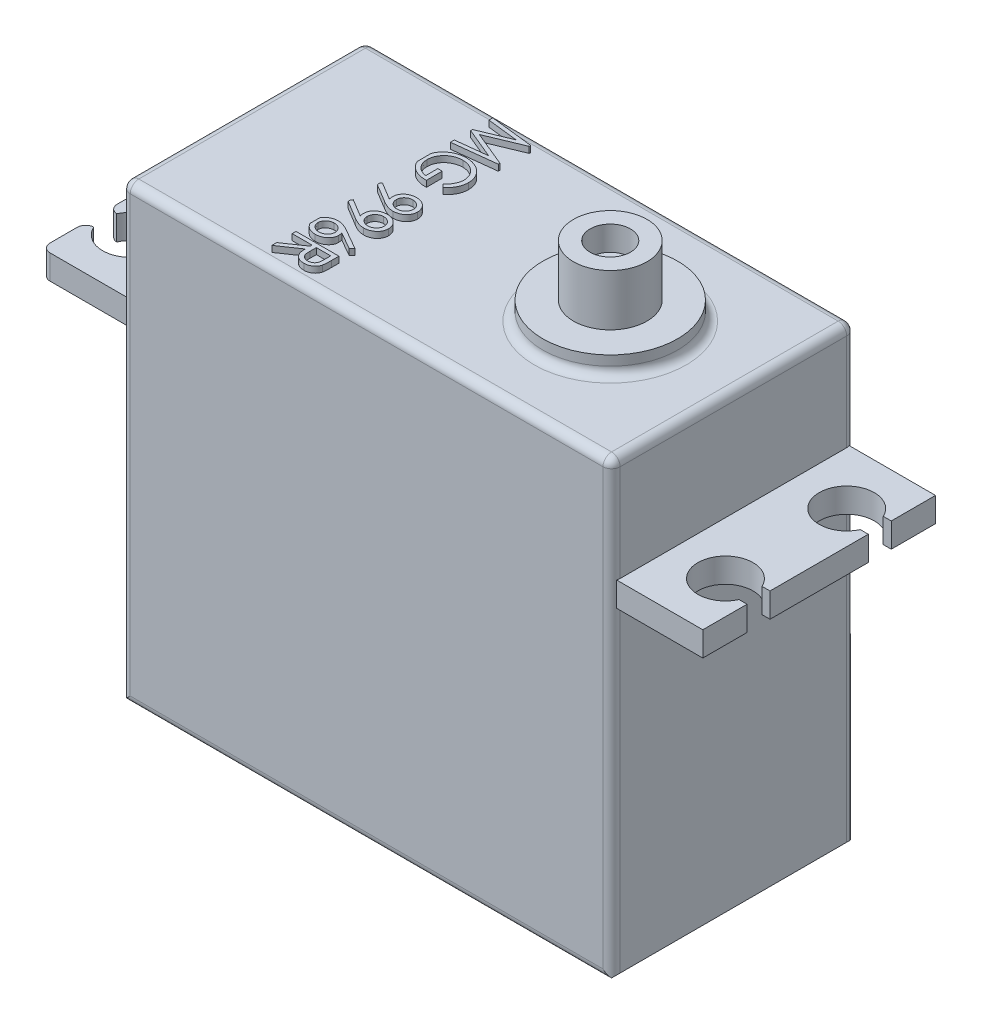
from build123d import *

# Parameters (mm, degrees)
SKETCH_1_W          = 40
SKETCH_1_H          = 26.9
EXTRUDE_1_DEPTH     = 19.9
CHAMFER_1_SIZE      = 1
SKETCH_2_W          = 20
SKETCH_2_H          = 14.45
SKETCH_2_H_2        = 4.55
SKETCH_2_H_3        = 0.45
EXTRUDE_2_DEPTH     = 2
FILLET_1_R          = 0.7
EXTRUDE_3_DEPTH     = 8.6
EXTRUDE_4_DEPTH     = 1.5
SKETCH_5_R          = 3
EXTRUDE_5_DEPTH     = 4.2
FILLET_2_R          = 0.7
EXTRUDE_6_DEPTH     = 0.5
SKETCH_7_R          = 1.65
CUT_EXTRUDE_1_DEPTH = 2


with BuildPart() as part:
    # 草图1 → 凸台-拉伸1 (new body)
    with BuildSketch(Plane.XY):
        with Locations((20, 13.45)):
            Rectangle(SKETCH_1_W, SKETCH_1_H)
    extrude(amount=-EXTRUDE_1_DEPTH)

    # 倒角1
    chamfer_1_edges = [part.edges().sort_by_distance(p)[0] for p in [
        (20, 0, 0),
        (40, 0, -9.95),
        (0, 0, -9.95),
        (20, 0, -19.9),
    ]]
    chamfer(chamfer_1_edges, length=CHAMFER_1_SIZE)

    # 草图2 → 凸台-拉伸2 (add)
    with BuildSketch(Plane(origin=(0, 26.9, 0), x_dir=(1, 0, 0), z_dir=(0, 1, 0))):
        with BuildLine():
            Line((0, 0.45), (0, 14.9))
            Line((0, 14.9), (-2.05, 14.9))
            ThreePointArc((-2.05, 14.9), (-3.819959848, 12.701804956), (-6.345165736, 13.962024993))
            Line((-6.345165736, 13.962024993), (-7, 13.962024993))
            Line((-7, 13.962024993), (-7, 5.937975007))
            Line((-7, 5.937975007), (-6.345165736, 5.937975007))
            ThreePointArc((-6.345165736, 5.937975007), (-3.819959848, 7.198195044), (-2.05, 5))
            ThreePointArc((-2.05, 5), (-3.819959848, 2.801804956), (-6.345165736, 4.062024993))
            Line((-6.345165736, 4.062024993), (-7, 4.062024993))
            Line((-7, 4.062024993), (-7, 0.45))
            Line((-7, 0.45), (0, 0.45))
        make_face()
        with BuildLine():
            Line((0, 14.9), (0, 19.45))
            Line((0, 19.45), (-7, 19.45))
            Line((-7, 19.45), (-7, 15.837975007))
            Line((-7, 15.837975007), (-6.345165736, 15.837975007))
            ThreePointArc((-6.345165736, 15.837975007), (-3.819959848, 17.098195044), (-2.05, 14.9))
            Line((-2.05, 14.9), (0, 14.9))
        make_face()
        with Locations((10, 7.675)):
            Rectangle(SKETCH_2_W, SKETCH_2_H)
        with Locations((10, 17.175)):
            Rectangle(SKETCH_2_W, SKETCH_2_H_2)
        with Locations((10, 19.675)):
            Rectangle(SKETCH_2_W, SKETCH_2_H_3)
        with Locations((10, 0.225)):
            Rectangle(SKETCH_2_W, SKETCH_2_H_3)
    extrude_2 = extrude(amount=EXTRUDE_2_DEPTH)

    # 圆角1
    # the kernel refuses this fillet: 0.7 mm, written as the material it takes off along each edge
    with BuildSketch(Plane(origin=(-7, 25.153646556, -4.062024993), x_dir=(1, 0, 0), z_dir=(0, 1, 0)), Plane(origin=(-7, 25.153646556, -13.962024993), x_dir=(1, 0, 0), z_dir=(0, 1, 0))) as fillet_1_piece_1:
        with BuildLine():
            CenterArc((0.7, -0.698541378), FILLET_1_R, 93.699435688, 86.300564312)
            Line((0, -0.698541378), (-0.014, -0.698541378))
            Line((-0.014, -0.698541378), (-0.014, 0))
            Line((-0.014, 0), (0, 0.014))
            ThreePointArc((0, 0.014), (0.327417132, 0.014), (0.65393095, 0.013970828))
            Line((0.65393095, 0.013970828), (0.654834264, 0))
        make_face()
    extrude(amount=5.492706888, mode=Mode.SUBTRACT)
    with BuildSketch(Plane(origin=(-7, 25.153646556, -5.937975007), x_dir=(0, 0, -1), z_dir=(0, 1, 0)), Plane(origin=(-7, 25.153646556, -15.837975007), x_dir=(0, 0, -1), z_dir=(0, 1, 0))) as fillet_1_piece_2:
        with BuildLine():
            CenterArc((0.698541378, -0.7), FILLET_1_R, 90, 86.300564312)
            Line((0, -0.654834264), (-0.013970828, -0.65393095))
            ThreePointArc((-0.013970828, -0.65393095), (-0.014, -0.327417132), (-0.014, 0))
            Line((-0.014, 0), (0, 0.014))
            Line((0, 0.014), (0.698541378, 0.014))
            Line((0.698541378, 0.014), (0.698541378, 0))
        make_face()
    extrude(amount=5.492706888, mode=Mode.SUBTRACT)
    with BuildSketch(Plane(origin=(-7, 25.15, -19.45), x_dir=(1, 0, 0), z_dir=(0, 1, 0)), Plane(origin=(-7, 25.15, -0.45), x_dir=(0, 0, -1), z_dir=(0, 1, 0))) as fillet_1_piece_3:
        with BuildLine():
            CenterArc((FILLET_1_R, -FILLET_1_R), FILLET_1_R, 90, 90)
            Line((0, -FILLET_1_R), (-FILLET_1_R * 0.02, -FILLET_1_R))
            Line((-FILLET_1_R * 0.02, -FILLET_1_R), (-FILLET_1_R * 0.02, FILLET_1_R * 0.02))
            Line((-FILLET_1_R * 0.02, FILLET_1_R * 0.02), (FILLET_1_R, FILLET_1_R * 0.02))
            Line((FILLET_1_R, FILLET_1_R * 0.02), (FILLET_1_R, 0))
        make_face()
    extrude(amount=5.5, mode=Mode.SUBTRACT)

    # 镜向1: 凸台-拉伸2 across plane
    add(extrude_2.mirror(Plane(origin=(20, 0, 0), x_dir=(0, 0, 1), z_dir=(1, 0, 0))))

    # 草图3 → 凸台-拉伸3 (add)
    with BuildSketch(Plane(origin=(0, 28.9, 0), x_dir=(1, 0, 0), z_dir=(0, 1, 0))):
        Polygon((40, 19.9), (0, 19.9), (0, 19.45), (0, 0.45), (0, 0), (40, 0), (40, 0.45), (40, 19.45), align=None)
    extrude(amount=EXTRUDE_3_DEPTH)

    # 草图4 → 凸台-拉伸4 (add)
    with BuildSketch(Plane(origin=(0, 37.5, 0), x_dir=(1, 0, 0), z_dir=(0, 1, 0))):
        with BuildLine():
            ThreePointArc((35.499708915, 9.95), (30, 15.393415143), (24.500291085, 9.95))
            Line((24.500291085, 9.95), (35.499708915, 9.95))
        make_face()
        with BuildLine():
            Line((35.499708915, 9.95), (24.500291085, 9.95))
            ThreePointArc((24.500291085, 9.95), (29.971707197, 4.393487915), (35.5, 9.893415143))
            ThreePointArc((35.5, 9.893415143), (35.499927228, 9.921707946), (35.499708915, 9.95))
        make_face()
    extrude(amount=EXTRUDE_4_DEPTH)

    # 草图5 → 凸台-拉伸5 (add)
    with BuildSketch(Plane(origin=(0, 39, 0), x_dir=(1, 0, 0), z_dir=(0, 1, 0))):
        with Locations(Location((30, 9.893415143, 0), (0, 0, 270))):
            Circle(SKETCH_5_R)
    extrude(amount=EXTRUDE_5_DEPTH)

    # 圆角2
    # the kernel refuses this fillet: 0.7 mm, written as the material it adds along each edge
    with BuildSketch(Plane(origin=(30, 37.5, -9.893415143), x_dir=(1, 0, 0), z_dir=(0, 0, 1))) as fillet_2_piece_1:
        with BuildLine():
            CenterArc((5.5 + FILLET_2_R, FILLET_2_R), FILLET_2_R, 180, 90)
            Line((5.5, FILLET_2_R), (5.5, 0))
            Line((5.5, 0), (5.5 + FILLET_2_R, 0))
        make_face()
    revolve(axis=Axis((30, 37.5, -9.893415143), (0, 1, 0)))
    # the kernel refuses this fillet: 0.7 mm, written as the material it takes off along each edge
    with BuildSketch(Plane(origin=(39.3, 36.8, -19.2), x_dir=(0, 1, 0), z_dir=(0, 0, -1))) as fillet_2_2_piece_1_section:
        Polygon((0, 0), (FILLET_2_R, 0), (FILLET_2_R, FILLET_2_R), (0, FILLET_2_R), align=None)
    fillet_2_2_piece_1 = extrude(amount=FILLET_2_R, mode=Mode.PRIVATE)
    fillet_2_2_piece_1 = fillet_2_2_piece_1 - Plane(origin=(39.3, 36.8, -19.2), x_dir=(-0.7071067811865475, -0.7071067811865475, 0), z_dir=(0, 0, -1)) * Sphere(FILLET_2_R, mode=Mode.PRIVATE)
    add(fillet_2_2_piece_1, mode=Mode.SUBTRACT)
    with BuildSketch(Plane(origin=(39.3, 36.8, -0.7), x_dir=(0, 0, 1), z_dir=(0, 1, 0))) as fillet_2_2_piece_2_section:
        Polygon((0, 0), (FILLET_2_R, 0), (FILLET_2_R, FILLET_2_R), (0, FILLET_2_R), align=None)
    fillet_2_2_piece_2 = extrude(amount=FILLET_2_R, mode=Mode.PRIVATE)
    fillet_2_2_piece_2 = fillet_2_2_piece_2 - Plane(origin=(39.3, 36.8, -0.7), x_dir=(-0.7071067811865475, 0, -0.7071067811865475), z_dir=(0, 1, 0)) * Sphere(FILLET_2_R, mode=Mode.PRIVATE)
    add(fillet_2_2_piece_2, mode=Mode.SUBTRACT)
    with BuildSketch(Plane(origin=(0.7, 36.8, -0.7), x_dir=(0, 0, 1), z_dir=(0, 1, 0))) as fillet_2_2_piece_3_section:
        Polygon((0, 0), (FILLET_2_R, 0), (FILLET_2_R, -FILLET_2_R), (0, -FILLET_2_R), align=None)
    fillet_2_2_piece_3 = extrude(amount=FILLET_2_R, mode=Mode.PRIVATE)
    fillet_2_2_piece_3 = fillet_2_2_piece_3 - Plane(origin=(0.7, 36.8, -0.7), x_dir=(0.7071067811865475, 0, -0.7071067811865475), z_dir=(0, 1, 0)) * Sphere(FILLET_2_R, mode=Mode.PRIVATE)
    add(fillet_2_2_piece_3, mode=Mode.SUBTRACT)
    with BuildSketch(Plane(origin=(0.7, 36.8, -19.2), x_dir=(0, 1, 0), z_dir=(0, 0, -1))) as fillet_2_2_piece_4_section:
        Polygon((0, 0), (FILLET_2_R, 0), (FILLET_2_R, -FILLET_2_R), (0, -FILLET_2_R), align=None)
    fillet_2_2_piece_4 = extrude(amount=FILLET_2_R, mode=Mode.PRIVATE)
    fillet_2_2_piece_4 = fillet_2_2_piece_4 - Plane(origin=(0.7, 36.8, -19.2), x_dir=(0.7071067811865475, -0.7071067811865475, 0), z_dir=(0, 0, -1)) * Sphere(FILLET_2_R, mode=Mode.PRIVATE)
    add(fillet_2_2_piece_4, mode=Mode.SUBTRACT)
    with BuildSketch(Plane(origin=(40, 37.5, -19.2), x_dir=(0, -1, 0), z_dir=(0, 0, 1)), Plane(origin=(0, 37.5, -0.7), x_dir=(0, -1, 0), z_dir=(0, 0, -1))) as fillet_2_2_piece_5:
        with BuildLine():
            CenterArc((FILLET_2_R, -FILLET_2_R), FILLET_2_R, 90, 90)
            Line((0, -FILLET_2_R), (0, 0))
            Line((0, 0), (FILLET_2_R, 0))
        make_face()
    extrude(amount=18.5, mode=Mode.SUBTRACT)
    with BuildSketch(Plane(origin=(0.7, 37.5, 0), x_dir=(0, -1, 0), z_dir=(1, 0, 0)), Plane(origin=(39.3, 37.5, -19.9), x_dir=(0, -1, 0), z_dir=(-1, 0, 0))) as fillet_2_2_piece_6:
        with BuildLine():
            CenterArc((FILLET_2_R, FILLET_2_R), FILLET_2_R, 180, 90)
            Line((0, FILLET_2_R), (0, 0))
            Line((0, 0), (FILLET_2_R, 0))
        make_face()
    extrude(amount=38.6, mode=Mode.SUBTRACT)
    with BuildSketch(Plane(origin=(0, 36.8, -19.9), x_dir=(0, 0, 1), z_dir=(0, -1, 0))) as fillet_2_2_piece_7_section:
        with BuildLine():
            CenterArc((FILLET_2_R, -FILLET_2_R), FILLET_2_R, 90, 90)
            Line((0, -FILLET_2_R), (0, 0))
            Line((0, 0), (FILLET_2_R, 0))
        make_face()
    fillet_2_2_piece_7 = extrude(amount=37.55, mode=Mode.PRIVATE)
    fillet_2_2_piece_7 = split(fillet_2_2_piece_7, bisect_by=Plane(origin=(0.003803526, 32.85, -19.45), z_dir=(0, 0, 1)), keep=Keep.TOP, mode=Mode.PRIVATE)
    fillet_2_2_piece_7 = split(fillet_2_2_piece_7, bisect_by=Plane(origin=(0.003803526, 28.9, -19.357731488), z_dir=(0, 1, 0)), keep=Keep.TOP, mode=Mode.PRIVATE)
    add(fillet_2_2_piece_7, mode=Mode.SUBTRACT)
    with BuildSketch(Plane(origin=(0, 36.8, -19.9), x_dir=(0, 0, 1), z_dir=(0, -1, 0))) as fillet_2_2_piece_8_section:
        with BuildLine():
            CenterArc((FILLET_2_R, -FILLET_2_R), FILLET_2_R, 90, 90)
            Line((0, -FILLET_2_R), (0, 0))
            Line((0, 0), (FILLET_2_R, 0))
        make_face()
    fillet_2_2_piece_8 = extrude(amount=37.55, mode=Mode.PRIVATE)
    fillet_2_2_piece_8 = split(fillet_2_2_piece_8, bisect_by=Plane(origin=(0.168066575, 32.85, -19.45), z_dir=(0, 0, -1)), keep=Keep.TOP, mode=Mode.PRIVATE)
    fillet_2_2_piece_8 = split(fillet_2_2_piece_8, bisect_by=Plane(origin=(0.168066575, 28.9, -19.765319179), z_dir=(0, 1, 0)), keep=Keep.TOP, mode=Mode.PRIVATE)
    add(fillet_2_2_piece_8, mode=Mode.SUBTRACT)
    with BuildSketch(Plane(origin=(0, 36.8, -19.9), x_dir=(0, 0, 1), z_dir=(0, -1, 0))) as fillet_2_2_piece_9_section:
        with BuildLine():
            CenterArc((FILLET_2_R, -FILLET_2_R), FILLET_2_R, 90, 90)
            Line((0, -FILLET_2_R), (0, 0))
            Line((0, 0), (FILLET_2_R, 0))
        make_face()
    fillet_2_2_piece_9 = extrude(amount=37.55, mode=Mode.PRIVATE)
    fillet_2_2_piece_9 = split(fillet_2_2_piece_9, bisect_by=Plane(origin=(0.168066575, 26.9, -19.765319179), z_dir=(0, 1, 0)), keep=Keep.TOP, mode=Mode.PRIVATE)
    fillet_2_2_piece_9 = split(fillet_2_2_piece_9, bisect_by=Plane(origin=(0.168066575, 27.9, -19.45), z_dir=(0, 0, -1)), keep=Keep.TOP, mode=Mode.PRIVATE)
    fillet_2_2_piece_9 = split(fillet_2_2_piece_9, bisect_by=Plane(origin=(0.168066575, 28.9, -19.765319179), z_dir=(0, -1, 0)), keep=Keep.TOP, mode=Mode.PRIVATE)
    add(fillet_2_2_piece_9, mode=Mode.SUBTRACT)
    with BuildSketch(Plane(origin=(0, 36.8, -19.9), x_dir=(0, 0, 1), z_dir=(0, -1, 0))) as fillet_2_2_piece_10_section:
        with BuildLine():
            CenterArc((FILLET_2_R, -FILLET_2_R), FILLET_2_R, 90, 90)
            Line((0, -FILLET_2_R), (0, 0))
            Line((0, 0), (FILLET_2_R, 0))
        make_face()
    fillet_2_2_piece_10 = extrude(amount=37.55, mode=Mode.PRIVATE)
    fillet_2_2_piece_10 = split(fillet_2_2_piece_10, bisect_by=Plane(origin=(0.003803526, 26.9, -19.357731488), z_dir=(0, -1, 0)), keep=Keep.TOP, mode=Mode.PRIVATE)
    fillet_2_2_piece_10 = split(fillet_2_2_piece_10, bisect_by=Plane(origin=(0.003803526, 13.075, -19.45), z_dir=(0, 0, 1)), keep=Keep.TOP, mode=Mode.PRIVATE)
    add(fillet_2_2_piece_10, mode=Mode.SUBTRACT)
    with BuildSketch(Plane(origin=(0, 36.8, -19.9), x_dir=(0, 0, 1), z_dir=(0, -1, 0))) as fillet_2_2_piece_11_section:
        with BuildLine():
            CenterArc((FILLET_2_R, -FILLET_2_R), FILLET_2_R, 90, 90)
            Line((0, -FILLET_2_R), (0, 0))
            Line((0, 0), (FILLET_2_R, 0))
        make_face()
    fillet_2_2_piece_11 = extrude(amount=37.55, mode=Mode.PRIVATE)
    fillet_2_2_piece_11 = split(fillet_2_2_piece_11, bisect_by=Plane(origin=(0.168066575, 26.9, -19.765319179), z_dir=(0, -1, 0)), keep=Keep.TOP, mode=Mode.PRIVATE)
    fillet_2_2_piece_11 = split(fillet_2_2_piece_11, bisect_by=Plane(origin=(0.168066575, 13.075, -19.45), z_dir=(0, 0, -1)), keep=Keep.TOP, mode=Mode.PRIVATE)
    add(fillet_2_2_piece_11, mode=Mode.SUBTRACT)
    with BuildSketch(Plane(origin=(0, 36.8, 0), x_dir=(1, 0, 0), z_dir=(0, -1, 0))) as fillet_2_2_piece_12_section:
        with BuildLine():
            CenterArc((FILLET_2_R, -FILLET_2_R), FILLET_2_R, 90, 90)
            Line((0, -FILLET_2_R), (0, 0))
            Line((0, 0), (FILLET_2_R, 0))
        make_face()
    fillet_2_2_piece_12 = extrude(amount=37.55, mode=Mode.PRIVATE)
    fillet_2_2_piece_12 = split(fillet_2_2_piece_12, bisect_by=Plane(origin=(0.168066575, 32.85, -0.45), z_dir=(0, 0, 1)), keep=Keep.TOP, mode=Mode.PRIVATE)
    fillet_2_2_piece_12 = split(fillet_2_2_piece_12, bisect_by=Plane(origin=(0.168066575, 28.9, -0.134680821), z_dir=(0, 1, 0)), keep=Keep.TOP, mode=Mode.PRIVATE)
    add(fillet_2_2_piece_12, mode=Mode.SUBTRACT)
    with BuildSketch(Plane(origin=(0, 36.8, 0), x_dir=(1, 0, 0), z_dir=(0, -1, 0))) as fillet_2_2_piece_13_section:
        with BuildLine():
            CenterArc((FILLET_2_R, -FILLET_2_R), FILLET_2_R, 90, 90)
            Line((0, -FILLET_2_R), (0, 0))
            Line((0, 0), (FILLET_2_R, 0))
        make_face()
    fillet_2_2_piece_13 = extrude(amount=37.55, mode=Mode.PRIVATE)
    fillet_2_2_piece_13 = split(fillet_2_2_piece_13, bisect_by=Plane(origin=(0.003803526, 32.85, -0.45), z_dir=(0, 0, -1)), keep=Keep.TOP, mode=Mode.PRIVATE)
    fillet_2_2_piece_13 = split(fillet_2_2_piece_13, bisect_by=Plane(origin=(0.003803526, 28.9, -0.542268512), z_dir=(0, 1, 0)), keep=Keep.TOP, mode=Mode.PRIVATE)
    add(fillet_2_2_piece_13, mode=Mode.SUBTRACT)
    with BuildSketch(Plane(origin=(0, 36.8, 0), x_dir=(1, 0, 0), z_dir=(0, -1, 0))) as fillet_2_2_piece_14_section:
        with BuildLine():
            CenterArc((FILLET_2_R, -FILLET_2_R), FILLET_2_R, 90, 90)
            Line((0, -FILLET_2_R), (0, 0))
            Line((0, 0), (FILLET_2_R, 0))
        make_face()
    fillet_2_2_piece_14 = extrude(amount=37.55, mode=Mode.PRIVATE)
    fillet_2_2_piece_14 = split(fillet_2_2_piece_14, bisect_by=Plane(origin=(0.168066575, 27.9, -0.45), z_dir=(0, 0, 1)), keep=Keep.TOP, mode=Mode.PRIVATE)
    fillet_2_2_piece_14 = split(fillet_2_2_piece_14, bisect_by=Plane(origin=(0.168066575, 26.9, -0.134680821), z_dir=(0, 1, 0)), keep=Keep.TOP, mode=Mode.PRIVATE)
    fillet_2_2_piece_14 = split(fillet_2_2_piece_14, bisect_by=Plane(origin=(0.168066575, 28.9, -0.134680821), z_dir=(0, -1, 0)), keep=Keep.TOP, mode=Mode.PRIVATE)
    add(fillet_2_2_piece_14, mode=Mode.SUBTRACT)
    with BuildSketch(Plane(origin=(0, 36.8, 0), x_dir=(1, 0, 0), z_dir=(0, -1, 0))) as fillet_2_2_piece_15_section:
        with BuildLine():
            CenterArc((FILLET_2_R, -FILLET_2_R), FILLET_2_R, 90, 90)
            Line((0, -FILLET_2_R), (0, 0))
            Line((0, 0), (FILLET_2_R, 0))
        make_face()
    fillet_2_2_piece_15 = extrude(amount=37.55, mode=Mode.PRIVATE)
    fillet_2_2_piece_15 = split(fillet_2_2_piece_15, bisect_by=Plane(origin=(0.168066575, 13.075, -0.45), z_dir=(0, 0, 1)), keep=Keep.TOP, mode=Mode.PRIVATE)
    fillet_2_2_piece_15 = split(fillet_2_2_piece_15, bisect_by=Plane(origin=(0.168066575, 26.9, -0.134680821), z_dir=(0, -1, 0)), keep=Keep.TOP, mode=Mode.PRIVATE)
    add(fillet_2_2_piece_15, mode=Mode.SUBTRACT)
    with BuildSketch(Plane(origin=(0, 36.8, 0), x_dir=(1, 0, 0), z_dir=(0, -1, 0))) as fillet_2_2_piece_16_section:
        with BuildLine():
            CenterArc((FILLET_2_R, -FILLET_2_R), FILLET_2_R, 90, 90)
            Line((0, -FILLET_2_R), (0, 0))
            Line((0, 0), (FILLET_2_R, 0))
        make_face()
    fillet_2_2_piece_16 = extrude(amount=37.55, mode=Mode.PRIVATE)
    fillet_2_2_piece_16 = split(fillet_2_2_piece_16, bisect_by=Plane(origin=(0.003803526, 13.075, -0.45), z_dir=(0, 0, -1)), keep=Keep.TOP, mode=Mode.PRIVATE)
    fillet_2_2_piece_16 = split(fillet_2_2_piece_16, bisect_by=Plane(origin=(0.003803526, 26.9, -0.542268512), z_dir=(0, -1, 0)), keep=Keep.TOP, mode=Mode.PRIVATE)
    add(fillet_2_2_piece_16, mode=Mode.SUBTRACT)
    with BuildSketch(Plane(origin=(-0.724873734, 1, -19.9), x_dir=(0, -0.7071067811865485, 0.7071067811865466), z_dir=(1, 0, 0))) as fillet_2_2_piece_17:
        with BuildLine():
            CenterArc((FILLET_2_R * 0.414213562373, -FILLET_2_R), FILLET_2_R, 90, 45)
            Line((-FILLET_2_R * 0.292893218813, -FILLET_2_R * 0.292893218813), (0, 0))
            Line((0, 0), (FILLET_2_R * 0.414213562373, 0))
        make_face()
    extrude(amount=41.449747468, mode=Mode.SUBTRACT)
    with BuildSketch(Plane(origin=(40, -0.75, 0), x_dir=(-1, 0, 0), z_dir=(0, 1, 0))) as fillet_2_2_piece_18_section:
        with BuildLine():
            CenterArc((FILLET_2_R, -FILLET_2_R), FILLET_2_R, 90, 90)
            Line((0, -FILLET_2_R), (0, 0))
            Line((0, 0), (FILLET_2_R, 0))
        make_face()
    fillet_2_2_piece_18 = extrude(amount=37.55, mode=Mode.PRIVATE)
    fillet_2_2_piece_18 = split(fillet_2_2_piece_18, bisect_by=Plane(origin=(39.831933425, 26.9, -0.134680821), z_dir=(0, -1, 0)), keep=Keep.TOP, mode=Mode.PRIVATE)
    fillet_2_2_piece_18 = split(fillet_2_2_piece_18, bisect_by=Plane(origin=(39.831933425, 13.075, -0.45), z_dir=(0, 0, 1)), keep=Keep.TOP, mode=Mode.PRIVATE)
    add(fillet_2_2_piece_18, mode=Mode.SUBTRACT)
    with BuildSketch(Plane(origin=(40, -0.75, 0), x_dir=(-1, 0, 0), z_dir=(0, 1, 0))) as fillet_2_2_piece_19_section:
        with BuildLine():
            CenterArc((FILLET_2_R, -FILLET_2_R), FILLET_2_R, 90, 90)
            Line((0, -FILLET_2_R), (0, 0))
            Line((0, 0), (FILLET_2_R, 0))
        make_face()
    fillet_2_2_piece_19 = extrude(amount=37.55, mode=Mode.PRIVATE)
    fillet_2_2_piece_19 = split(fillet_2_2_piece_19, bisect_by=Plane(origin=(39.996196474, 26.9, -0.542268512), z_dir=(0, -1, 0)), keep=Keep.TOP, mode=Mode.PRIVATE)
    fillet_2_2_piece_19 = split(fillet_2_2_piece_19, bisect_by=Plane(origin=(39.996196474, 13.075, -0.45), z_dir=(0, 0, -1)), keep=Keep.TOP, mode=Mode.PRIVATE)
    add(fillet_2_2_piece_19, mode=Mode.SUBTRACT)
    with BuildSketch(Plane(origin=(40, -0.75, 0), x_dir=(-1, 0, 0), z_dir=(0, 1, 0))) as fillet_2_2_piece_20_section:
        with BuildLine():
            CenterArc((FILLET_2_R, -FILLET_2_R), FILLET_2_R, 90, 90)
            Line((0, -FILLET_2_R), (0, 0))
            Line((0, 0), (FILLET_2_R, 0))
        make_face()
    fillet_2_2_piece_20 = extrude(amount=37.55, mode=Mode.PRIVATE)
    fillet_2_2_piece_20 = split(fillet_2_2_piece_20, bisect_by=Plane(origin=(39.831933425, 26.9, -0.134680821), z_dir=(0, 1, 0)), keep=Keep.TOP, mode=Mode.PRIVATE)
    fillet_2_2_piece_20 = split(fillet_2_2_piece_20, bisect_by=Plane(origin=(39.831933425, 27.9, -0.45), z_dir=(0, 0, 1)), keep=Keep.TOP, mode=Mode.PRIVATE)
    fillet_2_2_piece_20 = split(fillet_2_2_piece_20, bisect_by=Plane(origin=(39.831933425, 28.9, -0.134680821), z_dir=(0, -1, 0)), keep=Keep.TOP, mode=Mode.PRIVATE)
    add(fillet_2_2_piece_20, mode=Mode.SUBTRACT)
    with BuildSketch(Plane(origin=(40, -0.75, 0), x_dir=(-1, 0, 0), z_dir=(0, 1, 0))) as fillet_2_2_piece_21_section:
        with BuildLine():
            CenterArc((FILLET_2_R, -FILLET_2_R), FILLET_2_R, 90, 90)
            Line((0, -FILLET_2_R), (0, 0))
            Line((0, 0), (FILLET_2_R, 0))
        make_face()
    fillet_2_2_piece_21 = extrude(amount=37.55, mode=Mode.PRIVATE)
    fillet_2_2_piece_21 = split(fillet_2_2_piece_21, bisect_by=Plane(origin=(39.831933425, 32.85, -0.45), z_dir=(0, 0, 1)), keep=Keep.TOP, mode=Mode.PRIVATE)
    fillet_2_2_piece_21 = split(fillet_2_2_piece_21, bisect_by=Plane(origin=(39.831933425, 28.9, -0.134680821), z_dir=(0, 1, 0)), keep=Keep.TOP, mode=Mode.PRIVATE)
    add(fillet_2_2_piece_21, mode=Mode.SUBTRACT)
    with BuildSketch(Plane(origin=(40, -0.75, 0), x_dir=(-1, 0, 0), z_dir=(0, 1, 0))) as fillet_2_2_piece_22_section:
        with BuildLine():
            CenterArc((FILLET_2_R, -FILLET_2_R), FILLET_2_R, 90, 90)
            Line((0, -FILLET_2_R), (0, 0))
            Line((0, 0), (FILLET_2_R, 0))
        make_face()
    fillet_2_2_piece_22 = extrude(amount=37.55, mode=Mode.PRIVATE)
    fillet_2_2_piece_22 = split(fillet_2_2_piece_22, bisect_by=Plane(origin=(39.996196474, 32.85, -0.45), z_dir=(0, 0, -1)), keep=Keep.TOP, mode=Mode.PRIVATE)
    fillet_2_2_piece_22 = split(fillet_2_2_piece_22, bisect_by=Plane(origin=(39.996196474, 28.9, -0.542268512), z_dir=(0, 1, 0)), keep=Keep.TOP, mode=Mode.PRIVATE)
    add(fillet_2_2_piece_22, mode=Mode.SUBTRACT)
    with BuildSketch(Plane(origin=(40, -0.75, -19.9), x_dir=(0, 0, 1), z_dir=(0, 1, 0))) as fillet_2_2_piece_23_section:
        with BuildLine():
            CenterArc((FILLET_2_R, -FILLET_2_R), FILLET_2_R, 90, 90)
            Line((0, -FILLET_2_R), (0, 0))
            Line((0, 0), (FILLET_2_R, 0))
        make_face()
    fillet_2_2_piece_23 = extrude(amount=37.55, mode=Mode.PRIVATE)
    fillet_2_2_piece_23 = split(fillet_2_2_piece_23, bisect_by=Plane(origin=(39.996196474, 13.075, -19.45), z_dir=(0, 0, 1)), keep=Keep.TOP, mode=Mode.PRIVATE)
    fillet_2_2_piece_23 = split(fillet_2_2_piece_23, bisect_by=Plane(origin=(39.996196474, 26.9, -19.357731488), z_dir=(0, -1, 0)), keep=Keep.TOP, mode=Mode.PRIVATE)
    add(fillet_2_2_piece_23, mode=Mode.SUBTRACT)
    with BuildSketch(Plane(origin=(40, -0.75, -19.9), x_dir=(0, 0, 1), z_dir=(0, 1, 0))) as fillet_2_2_piece_24_section:
        with BuildLine():
            CenterArc((FILLET_2_R, -FILLET_2_R), FILLET_2_R, 90, 90)
            Line((0, -FILLET_2_R), (0, 0))
            Line((0, 0), (FILLET_2_R, 0))
        make_face()
    fillet_2_2_piece_24 = extrude(amount=37.55, mode=Mode.PRIVATE)
    fillet_2_2_piece_24 = split(fillet_2_2_piece_24, bisect_by=Plane(origin=(39.831933425, 13.075, -19.45), z_dir=(0, 0, -1)), keep=Keep.TOP, mode=Mode.PRIVATE)
    fillet_2_2_piece_24 = split(fillet_2_2_piece_24, bisect_by=Plane(origin=(39.831933425, 26.9, -19.765319179), z_dir=(0, -1, 0)), keep=Keep.TOP, mode=Mode.PRIVATE)
    add(fillet_2_2_piece_24, mode=Mode.SUBTRACT)
    with BuildSketch(Plane(origin=(40, -0.75, -19.9), x_dir=(0, 0, 1), z_dir=(0, 1, 0))) as fillet_2_2_piece_25_section:
        with BuildLine():
            CenterArc((FILLET_2_R, -FILLET_2_R), FILLET_2_R, 90, 90)
            Line((0, -FILLET_2_R), (0, 0))
            Line((0, 0), (FILLET_2_R, 0))
        make_face()
    fillet_2_2_piece_25 = extrude(amount=37.55, mode=Mode.PRIVATE)
    fillet_2_2_piece_25 = split(fillet_2_2_piece_25, bisect_by=Plane(origin=(39.831933425, 27.9, -19.45), z_dir=(0, 0, -1)), keep=Keep.TOP, mode=Mode.PRIVATE)
    fillet_2_2_piece_25 = split(fillet_2_2_piece_25, bisect_by=Plane(origin=(39.831933425, 26.9, -19.765319179), z_dir=(0, 1, 0)), keep=Keep.TOP, mode=Mode.PRIVATE)
    fillet_2_2_piece_25 = split(fillet_2_2_piece_25, bisect_by=Plane(origin=(39.831933425, 28.9, -19.765319179), z_dir=(0, -1, 0)), keep=Keep.TOP, mode=Mode.PRIVATE)
    add(fillet_2_2_piece_25, mode=Mode.SUBTRACT)
    with BuildSketch(Plane(origin=(40, -0.75, -19.9), x_dir=(0, 0, 1), z_dir=(0, 1, 0))) as fillet_2_2_piece_26_section:
        with BuildLine():
            CenterArc((FILLET_2_R, -FILLET_2_R), FILLET_2_R, 90, 90)
            Line((0, -FILLET_2_R), (0, 0))
            Line((0, 0), (FILLET_2_R, 0))
        make_face()
    fillet_2_2_piece_26 = extrude(amount=37.55, mode=Mode.PRIVATE)
    fillet_2_2_piece_26 = split(fillet_2_2_piece_26, bisect_by=Plane(origin=(39.996196474, 32.85, -19.45), z_dir=(0, 0, 1)), keep=Keep.TOP, mode=Mode.PRIVATE)
    fillet_2_2_piece_26 = split(fillet_2_2_piece_26, bisect_by=Plane(origin=(39.996196474, 28.9, -19.357731488), z_dir=(0, 1, 0)), keep=Keep.TOP, mode=Mode.PRIVATE)
    add(fillet_2_2_piece_26, mode=Mode.SUBTRACT)
    with BuildSketch(Plane(origin=(40, -0.75, -19.9), x_dir=(0, 0, 1), z_dir=(0, 1, 0))) as fillet_2_2_piece_27_section:
        with BuildLine():
            CenterArc((FILLET_2_R, -FILLET_2_R), FILLET_2_R, 90, 90)
            Line((0, -FILLET_2_R), (0, 0))
            Line((0, 0), (FILLET_2_R, 0))
        make_face()
    fillet_2_2_piece_27 = extrude(amount=37.55, mode=Mode.PRIVATE)
    fillet_2_2_piece_27 = split(fillet_2_2_piece_27, bisect_by=Plane(origin=(39.831933425, 32.85, -19.45), z_dir=(0, 0, -1)), keep=Keep.TOP, mode=Mode.PRIVATE)
    fillet_2_2_piece_27 = split(fillet_2_2_piece_27, bisect_by=Plane(origin=(39.831933425, 28.9, -19.765319179), z_dir=(0, 1, 0)), keep=Keep.TOP, mode=Mode.PRIVATE)
    add(fillet_2_2_piece_27, mode=Mode.SUBTRACT)
    with BuildSketch(Plane(origin=(-0.724873734, 1, 0), x_dir=(0, -0.7071067811865475, -0.7071067811865475), z_dir=(1, 0, 0))) as fillet_2_2_piece_28:
        with BuildLine():
            CenterArc((FILLET_2_R * 0.414213562373, FILLET_2_R), FILLET_2_R, 225, 45)
            Line((-FILLET_2_R * 0.292893218813, FILLET_2_R * 0.292893218813), (0, 0))
            Line((0, 0), (FILLET_2_R * 0.414213562373, 0))
        make_face()
    extrude(amount=41.449747468, mode=Mode.SUBTRACT)

    # 草图6 → 凸台-拉伸6 (add)
    # profile 1 of 6: a face of its own
    with BuildSketch(Plane(origin=(0, 37.5, 0), x_dir=(1, 0, 0), z_dir=(0, 1, 0))):
        Polygon((14.82671009, 18.573197115), (11.32671009, 18.975641026), (11.32671009, 18.658733974), (13.839530603, 18.369871795), (11.32671009, 17.322395833), (11.32671009, 17.169551282), (13.839530603, 16.126282051), (11.32671009, 15.83671875), (11.32671009, 15.520512821), (14.82671009, 15.923657853), (14.82671009, 16.05546875), (11.954915219, 17.248076923), (14.82671009, 18.445592949), align=None)
    # profile 2 of 6: a face of its own
    with BuildSketch(Plane(origin=(0, 37.5, 0), x_dir=(1, 0, 0), z_dir=(0, 1, 0))):
        with BuildLine():
            add(Edge.make_bspline(
                [(11.32671009, 13.935122937), (11.327867723, 13.938449887), (11.339348449, 13.971095112), (11.363088213, 14.032340901), (11.401441924, 14.117344058), (11.445614996, 14.199263127), (11.495212043, 14.278117978), (11.54898689, 14.354840965), (11.608869168, 14.428273592), (11.673404266, 14.499507979), (11.768327407, 14.590723981), (11.844518075, 14.655107226), (11.898825475, 14.694591346)],
                knots=[0.375564689, 0.375564689, 0.375564689, 0.375564689, 0.38239591, 0.442673365, 0.502926951, 0.563166892, 0.623040692, 0.68353935, 0.744780765, 0.806714573, 0.869870681, 1, 1, 1, 1], degree=3))
            Line((11.32671009, 13.935122937), (11.32671009, 12.819519156))
            add(Edge.make_bspline(
                [(13.031838296, 11.841025641), (12.90113296, 11.842643179), (12.709231601, 11.853505977), (12.462901431, 11.898197707), (12.293501161, 11.944777366), (12.133991891, 12.002586987), (11.985529976, 12.074265787), (11.847839904, 12.159110234), (11.721184394, 12.255327065), (11.607353538, 12.362683896), (11.507688304, 12.479484338), (11.423782683, 12.605717661), (11.365695952, 12.72054194), (11.33641452, 12.793118561), (11.32671009, 12.819519156)],
                knots=[0, 0, 0, 0, 0.147969788, 0.21678684, 0.282852908, 0.346509057, 0.408473489, 0.469011293, 0.52919006, 0.588105644, 0.64569153, 0.702522862, 0.759161978, 0.790967028, 0.790967028, 0.790967028, 0.790967028], degree=3))
            Line((13.031838296, 11.841025641), (13.031838296, 13.142307692))
            Line((13.031838296, 13.142307692), (12.672863937, 13.142307692))
            Line((12.672863937, 13.142307692), (12.672863937, 12.155128205))
            add(Edge.make_bspline(
                [(11.59594086, 13.342828526), (11.596067573, 13.266762548), (11.605166868, 13.154090065), (11.636001436, 13.008621877), (11.669211264, 12.905858692), (11.711578994, 12.807787149), (11.762937812, 12.713933322), (11.824173176, 12.624822751), (11.89426511, 12.540948781), (11.971412123, 12.46339364), (12.05562536, 12.394417814), (12.144685273, 12.333295051), (12.239336347, 12.280142381), (12.339737836, 12.236190895), (12.483085184, 12.187698745), (12.595726273, 12.164174663), (12.672863937, 12.155128205)],
                knots=[0, 0, 0, 0, 0.129434198, 0.191692175, 0.25270126, 0.312922054, 0.373270138, 0.434503139, 0.496636466, 0.559077153, 0.620396653, 0.681629653, 0.742711309, 0.80486755, 0.867887087, 1, 1, 1, 1], degree=3))
            add(Edge.make_bspline(
                [(13.09213477, 14.757692308), (13.027632768, 14.758402044), (12.931461079, 14.751079173), (12.804556035, 14.73291489), (12.710862155, 14.712417391), (12.618622988, 14.685428818), (12.527010217, 14.654235476), (12.437284565, 14.616034274), (12.349308432, 14.572692598), (12.263907071, 14.524878464), (12.183290088, 14.471096421), (12.10665889, 14.414132656), (12.035728445, 14.351470738), (11.96791457, 14.286234591), (11.906490661, 14.214667077), (11.84850352, 14.139723761), (11.796385799, 14.060047379), (11.749493667, 13.977300269), (11.7079059, 13.892785324), (11.673411707, 13.805985939), (11.645431484, 13.717105503), (11.622660292, 13.626364961), (11.602610468, 13.501546286), (11.594871419, 13.406675149), (11.59594086, 13.342828526)],
                knots=[0, 0, 0, 0, 0.084409654, 0.126197064, 0.167877766, 0.209936892, 0.2520595, 0.294597393, 0.337595641, 0.380512046, 0.422719149, 0.464484116, 0.505501603, 0.546641194, 0.587658681, 0.628935918, 0.670718841, 0.712267747, 0.753487024, 0.794027447, 0.83450538, 0.875498859, 0.916474038, 1, 1, 1, 1], degree=3))
            add(Edge.make_bspline(
                [(14.557479321, 13.401722756), (14.558352598, 13.460656293), (14.550873781, 13.548609536), (14.530456472, 13.664377572), (14.508707694, 13.749928824), (14.480410441, 13.834444475), (14.446107974, 13.917899118), (14.405129759, 14.000247167), (14.358337798, 14.080894887), (14.307049101, 14.159378233), (14.249753772, 14.232937157), (14.188974647, 14.302806515), (14.122639681, 14.367215054), (14.052406476, 14.427628632), (13.97801703, 14.48407994), (13.898644344, 14.53511181), (13.815369802, 14.581236709), (13.72942426, 14.622026769), (13.642381125, 14.65938549), (13.553186299, 14.688747404), (13.463596751, 14.714669126), (13.372314145, 14.73325579), (13.248942522, 14.752268339), (13.154902479, 14.757668191), (13.09213477, 14.757692308)],
                knots=[0, 0, 0, 0, 0.079705095, 0.119250487, 0.159088605, 0.199121103, 0.239850603, 0.281179432, 0.323575387, 0.366059846, 0.408029581, 0.449740774, 0.491367834, 0.533110233, 0.575139589, 0.617715896, 0.66078224, 0.703956598, 0.746511727, 0.788946646, 0.8310284, 0.872739592, 0.914992372, 1, 1, 1, 1], degree=3))
            add(Edge.make_bspline(
                [(13.974145988, 12.257491987), (14.065517763, 12.338657195), (14.191578718, 12.468501209), (14.328005173, 12.662237732), (14.410344145, 12.809828531), (14.475889346, 12.959308054), (14.536794644, 13.154588912), (14.558174408, 13.303732445), (14.557479321, 13.401722756)],
                knots=[0, 0, 0, 0, 0.277513518, 0.408467851, 0.536683957, 0.660434724, 0.778193249, 1, 1, 1, 1], degree=3))
            Line((13.974145988, 12.257491987), (14.229354321, 12.020512821))
            add(Edge.make_bspline(
                [(14.91645368, 13.409435096), (14.916132488, 13.3459906), (14.911214014, 13.25136393), (14.894049108, 13.126733722), (14.876914037, 13.035068762), (14.853440505, 12.945054141), (14.825202323, 12.856418321), (14.792648242, 12.768831407), (14.753593117, 12.682849493), (14.709321609, 12.597914853), (14.659507674, 12.513475633), (14.602997983, 12.429912131), (14.540687696, 12.346485716), (14.471815198, 12.263709505), (14.369831747, 12.152614462), (14.287178943, 12.072651792), (14.229354321, 12.020512821)],
                knots=[0, 0, 0, 0, 0.118937456, 0.177297226, 0.23571944, 0.293625312, 0.351536154, 0.410037148, 0.468661025, 0.528421226, 0.589501104, 0.65231576, 0.717412324, 0.78460646, 0.854061573, 1, 1, 1, 1], degree=3))
            add(Edge.make_bspline(
                [(13.078112334, 15.071794872), (13.159808567, 15.07138561), (13.281722319, 15.065473606), (13.441691358, 15.042963931), (13.558739536, 15.018956699), (13.673402892, 14.988108038), (13.786301158, 14.950817808), (13.896737579, 14.906651625), (14.004781426, 14.85631853), (14.108310441, 14.799806724), (14.207282986, 14.738828259), (14.299737517, 14.671906798), (14.387205139, 14.600639732), (14.467536076, 14.523033875), (14.543237245, 14.441549546), (14.612588064, 14.354592646), (14.675616146, 14.262609853), (14.732366294, 14.16696175), (14.781642161, 14.067848638), (14.823022843, 13.965565498), (14.857754833, 13.860567744), (14.883407968, 13.751847798), (14.90879883, 13.601849435), (14.917316157, 13.486836953), (14.91645368, 13.409435096)],
                knots=[0, 0, 0, 0, 0.088674324, 0.132217021, 0.175191713, 0.218256116, 0.261003449, 0.304143215, 0.347258371, 0.390270466, 0.432074469, 0.473320834, 0.514042216, 0.554402645, 0.594426998, 0.634669321, 0.67497872, 0.715343133, 0.755267723, 0.794970169, 0.834991308, 0.875160038, 0.916062667, 1, 1, 1, 1], degree=3))
            add(Edge.make_bspline(
                [(11.898825475, 14.694591346), (11.982193271, 14.757122266), (12.115192237, 14.838526832), (12.302678884, 14.92670466), (12.448074866, 14.980161942), (12.598856675, 15.020578223), (12.808277993, 15.060275856), (12.969473372, 15.072657826), (13.078112334, 15.071794872)],
                knots=[0, 0, 0, 0, 0.24791267, 0.370152827, 0.492867091, 0.616254594, 0.741442379, 1, 1, 1, 1], degree=3))
        make_face()
    # profile 3 of 6: a face of its own
    with BuildSketch(Plane(origin=(0, 37.5, 0), x_dir=(1, 0, 0), z_dir=(0, 1, 0))):
        with BuildLine():
            Line((11.422763776, 9.865965545), (11.32671009, 9.727140784))
            Line((11.32671009, 9.727140784), (11.32671009, 9.543541838))
            Line((11.32671009, 9.543541838), (12.813088296, 8.650921474))
            add(Edge.make_bspline(
                [(13.840932847, 8.296153846), (13.766382215, 8.29582781), (13.652823633, 8.307376259), (13.501207674, 8.338473891), (13.381339672, 8.372828064), (13.254360908, 8.419981593), (13.061860733, 8.509950061), (12.913678866, 8.589280087), (12.813088296, 8.650921474)],
                knots=[0, 0, 0, 0, 0.20283691, 0.310115467, 0.421377824, 0.542268128, 0.678765074, 1, 1, 1, 1], degree=3))
            add(Edge.make_bspline(
                [(14.91645368, 9.248277244), (14.915721475, 9.16394733), (14.899710819, 9.03696365), (14.839490485, 8.878082406), (14.7777783, 8.765230679), (14.700233405, 8.661042005), (14.607647882, 8.567879019), (14.500900995, 8.486917273), (14.381569059, 8.419113038), (14.253604917, 8.364456335), (14.074439764, 8.311816944), (13.934571366, 8.295482729), (13.840932847, 8.296153846)],
                knots=[0, 0, 0, 0, 0.158566595, 0.23730481, 0.317823027, 0.399359668, 0.480350067, 0.563643903, 0.650135199, 0.737433206, 0.824358707, 1, 1, 1, 1], degree=3))
            add(Edge.make_bspline(
                [(13.844438456, 10.225641026), (13.940339281, 10.226223123), (14.082303665, 10.210927693), (14.262008901, 10.15778534), (14.386598855, 10.102838386), (14.501758808, 10.033824496), (14.604922928, 9.950111016), (14.69657563, 9.853804882), (14.774305287, 9.745064605), (14.837069841, 9.627890107), (14.899551491, 9.464729136), (14.915754514, 9.334464401), (14.91645368, 9.248277244)],
                knots=[0, 0, 0, 0, 0.178081115, 0.263244562, 0.347218973, 0.430385963, 0.51188522, 0.593265287, 0.676639386, 0.759382629, 0.839616267, 1, 1, 1, 1], degree=3))
            add(Edge.make_bspline(
                [(12.807479321, 9.327504006), (12.807650298, 9.387979543), (12.816683421, 9.477882533), (12.847977575, 9.593208966), (12.880786497, 9.675178191), (12.923763947, 9.753112727), (12.975000156, 9.827941609), (13.036596466, 9.898681496), (13.106067961, 9.965608247), (13.182893832, 10.026003732), (13.264287689, 10.079715659), (13.350587003, 10.124791171), (13.440927641, 10.161914988), (13.535715237, 10.190950435), (13.669920154, 10.218317814), (13.77410442, 10.225240573), (13.844438456, 10.225641026)],
                knots=[0, 0, 0, 0, 0.118833366, 0.176430168, 0.234333727, 0.29187558, 0.350981329, 0.41219913, 0.475858965, 0.540264791, 0.603951123, 0.667218833, 0.731265099, 0.795618511, 0.861725876, 1, 1, 1, 1], degree=3))
            add(Edge.make_bspline(
                [(12.845339898, 9.011298077), (12.831990276, 9.06456858), (12.816156537, 9.169819902), (12.806439825, 9.275846915), (12.807479321, 9.327504006)],
                knots=[0, 0, 0, 0, 0.515350385, 1, 1, 1, 1], degree=3))
            Line((12.845339898, 9.011298077), (11.422763776, 9.865965545))
        make_face()
        with BuildLine():
            add(Edge.make_bspline(
                [(13.16645368, 9.257391827), (13.16723103, 9.213529419), (13.172020968, 9.148040753), (13.194029727, 9.064456974), (13.216691581, 9.005391444), (13.244880697, 8.948517303), (13.279902534, 8.894612269), (13.322035273, 8.843881704), (13.368984313, 8.795738908), (13.421400334, 8.752939734), (13.476320566, 8.714669157), (13.533898236, 8.682042931), (13.594851626, 8.656470707), (13.657607622, 8.63475076), (13.746867044, 8.616684866), (13.81534297, 8.609412042), (13.861966501, 8.61025641)],
                knots=[0, 0, 0, 0, 0.124631985, 0.184912707, 0.244486139, 0.303763918, 0.364610328, 0.426302665, 0.490506958, 0.554997941, 0.61787152, 0.680183718, 0.742231019, 0.805104598, 0.868149102, 1, 1, 1, 1], degree=3))
            add(Edge.make_bspline(
                [(13.861966501, 9.911538462), (13.815536095, 9.911602266), (13.746394892, 9.906592868), (13.658006249, 9.884877076), (13.594328516, 9.865286662), (13.534116137, 9.83728502), (13.476059432, 9.804459454), (13.42137434, 9.76457232), (13.369203066, 9.720408455), (13.321710739, 9.671607308), (13.280335185, 9.619588736), (13.244820581, 9.565613299), (13.216707554, 9.508678295), (13.194025531, 9.449628996), (13.17208279, 9.36626579), (13.167267333, 9.301022491), (13.16645368, 9.257391827)],
                knots=[0, 0, 0, 0, 0.131403182, 0.194524557, 0.256978918, 0.319349401, 0.381775815, 0.445197122, 0.510318742, 0.574777126, 0.637287344, 0.697927142, 0.757003637, 0.816374779, 0.87645081, 1, 1, 1, 1], degree=3))
            add(Edge.make_bspline(
                [(14.557479321, 9.261598558), (14.556516355, 9.304963593), (14.552022709, 9.369833757), (14.529725492, 9.452607765), (14.507378815, 9.511672153), (14.478433165, 9.568102235), (14.442932408, 9.621733245), (14.401325455, 9.673105272), (14.3540193, 9.721500582), (14.30269035, 9.766549391), (14.246968918, 9.804757226), (14.189526462, 9.838122126), (14.129087596, 9.864987074), (14.066196128, 9.886048791), (13.977275292, 9.905785231), (13.908506738, 9.912026794), (13.861966501, 9.911538462)],
                knots=[0, 0, 0, 0, 0.123287525, 0.182917215, 0.242480596, 0.302047664, 0.362329144, 0.424525024, 0.48919212, 0.554021969, 0.617807153, 0.6804357, 0.742131864, 0.804994838, 0.868171344, 1, 1, 1, 1], degree=3))
            add(Edge.make_bspline(
                [(13.861966501, 8.61025641), (13.908503872, 8.609773124), (13.977280771, 8.615999995), (14.066188288, 8.635759883), (14.129116635, 8.656756675), (14.189314286, 8.683813572), (14.247178878, 8.716200132), (14.302657061, 8.754601109), (14.354034612, 8.799573461), (14.401298289, 8.848009717), (14.44314477, 8.89945015), (14.47843588, 8.9537217), (14.507227509, 9.01066329), (14.529746231, 9.069879023), (14.552068352, 9.152894669), (14.556560352, 9.217997646), (14.557479321, 9.261598558)],
                knots=[0, 0, 0, 0, 0.131633841, 0.194716987, 0.257487062, 0.319092053, 0.38130167, 0.444992593, 0.509726638, 0.57429817, 0.636402138, 0.697148381, 0.757217007, 0.816692367, 0.876233937, 1, 1, 1, 1], degree=3))
        make_face(mode=Mode.SUBTRACT)
    # profile 4 of 6: a face of its own
    with BuildSketch(Plane(origin=(0, 37.5, 0), x_dir=(1, 0, 0), z_dir=(0, 1, 0))):
        with BuildLine():
            Line((11.422763776, 7.487760417), (11.32671009, 7.348935656))
            Line((11.32671009, 7.348935656), (11.32671009, 7.16533671))
            Line((11.32671009, 7.16533671), (12.813088296, 6.272716346))
            add(Edge.make_bspline(
                [(13.840932847, 5.917948718), (13.766382215, 5.917622681), (13.652823633, 5.92917113), (13.501207674, 5.960268763), (13.381339672, 5.994622935), (13.254360908, 6.041776465), (13.061860733, 6.131744933), (12.913678866, 6.211074958), (12.813088296, 6.272716346)],
                knots=[0, 0, 0, 0, 0.20283691, 0.310115467, 0.421377824, 0.542268128, 0.678765074, 1, 1, 1, 1], degree=3))
            add(Edge.make_bspline(
                [(14.91645368, 6.870072115), (14.915721475, 6.785742201), (14.899710819, 6.658758522), (14.839490485, 6.499877278), (14.7777783, 6.387025551), (14.700233405, 6.282836876), (14.607647882, 6.189673891), (14.500900995, 6.108712145), (14.381569059, 6.04090791), (14.253604917, 5.986251207), (14.074439764, 5.933611815), (13.934571366, 5.917277601), (13.840932847, 5.917948718)],
                knots=[0, 0, 0, 0, 0.158566595, 0.23730481, 0.317823027, 0.399359668, 0.480350067, 0.563643903, 0.650135199, 0.737433206, 0.824358707, 1, 1, 1, 1], degree=3))
            add(Edge.make_bspline(
                [(13.844438456, 7.847435897), (13.940339281, 7.848017994), (14.082303665, 7.832722565), (14.262008901, 7.779580212), (14.386598855, 7.724633258), (14.501758808, 7.655619368), (14.604922928, 7.571905888), (14.69657563, 7.475599754), (14.774305287, 7.366859476), (14.837069841, 7.249684979), (14.899551491, 7.086524008), (14.915754514, 6.956259273), (14.91645368, 6.870072115)],
                knots=[0, 0, 0, 0, 0.178081115, 0.263244562, 0.347218973, 0.430385963, 0.51188522, 0.593265287, 0.676639386, 0.759382629, 0.839616267, 1, 1, 1, 1], degree=3))
            add(Edge.make_bspline(
                [(12.807479321, 6.949298878), (12.807650298, 7.009774415), (12.816683421, 7.099677405), (12.847977575, 7.215003838), (12.880786497, 7.296973063), (12.923763947, 7.374907599), (12.975000156, 7.449736481), (13.036596466, 7.520476368), (13.106067961, 7.587403119), (13.182893832, 7.647798604), (13.264287689, 7.701510531), (13.350587003, 7.746586043), (13.440927641, 7.783709859), (13.535715237, 7.812745307), (13.669920154, 7.840112686), (13.77410442, 7.847035445), (13.844438456, 7.847435897)],
                knots=[0, 0, 0, 0, 0.118833366, 0.176430168, 0.234333727, 0.29187558, 0.350981329, 0.41219913, 0.475858965, 0.540264791, 0.603951123, 0.667218833, 0.731265099, 0.795618511, 0.861725876, 1, 1, 1, 1], degree=3))
            add(Edge.make_bspline(
                [(12.845339898, 6.633092949), (12.831990276, 6.686363452), (12.816156537, 6.791614774), (12.806439825, 6.897641787), (12.807479321, 6.949298878)],
                knots=[0, 0, 0, 0, 0.515350385, 1, 1, 1, 1], degree=3))
            Line((12.845339898, 6.633092949), (11.422763776, 7.487760417))
        make_face()
        with BuildLine():
            add(Edge.make_bspline(
                [(13.16645368, 6.879186699), (13.16723103, 6.835324291), (13.172020968, 6.769835625), (13.194029727, 6.686251846), (13.216691581, 6.627186316), (13.244880697, 6.570312175), (13.279902534, 6.516407141), (13.322035273, 6.465676576), (13.368984313, 6.41753378), (13.421400334, 6.374734606), (13.476320566, 6.336464029), (13.533898236, 6.303837802), (13.594851626, 6.278265579), (13.657607622, 6.256545632), (13.746867044, 6.238479738), (13.81534297, 6.231206914), (13.861966501, 6.232051282)],
                knots=[0, 0, 0, 0, 0.124631985, 0.184912707, 0.244486139, 0.303763918, 0.364610328, 0.426302665, 0.490506958, 0.554997941, 0.61787152, 0.680183718, 0.742231019, 0.805104598, 0.868149102, 1, 1, 1, 1], degree=3))
            add(Edge.make_bspline(
                [(13.861966501, 7.533333333), (13.815536095, 7.533397137), (13.746394892, 7.528387739), (13.658006249, 7.506671948), (13.594328516, 7.487081534), (13.534116137, 7.459079892), (13.476059432, 7.426254326), (13.42137434, 7.386367192), (13.369203066, 7.342203327), (13.321710739, 7.29340218), (13.280335185, 7.241383607), (13.244820581, 7.187408171), (13.216707554, 7.130473167), (13.194025531, 7.071423868), (13.17208279, 6.988060662), (13.167267333, 6.922817363), (13.16645368, 6.879186699)],
                knots=[0, 0, 0, 0, 0.131403182, 0.194524557, 0.256978918, 0.319349401, 0.381775815, 0.445197122, 0.510318742, 0.574777126, 0.637287344, 0.697927142, 0.757003637, 0.816374779, 0.87645081, 1, 1, 1, 1], degree=3))
            add(Edge.make_bspline(
                [(14.557479321, 6.883393429), (14.556516355, 6.926758465), (14.552022709, 6.991628628), (14.529725492, 7.074402637), (14.507378815, 7.133467025), (14.478433165, 7.189897107), (14.442932408, 7.243528117), (14.401325455, 7.294900144), (14.3540193, 7.343295454), (14.30269035, 7.388344263), (14.246968918, 7.426552097), (14.189526462, 7.459916998), (14.129087596, 7.486781946), (14.066196128, 7.507843663), (13.977275292, 7.527580103), (13.908506738, 7.533821665), (13.861966501, 7.533333333)],
                knots=[0, 0, 0, 0, 0.123287525, 0.182917215, 0.242480596, 0.302047664, 0.362329144, 0.424525024, 0.48919212, 0.554021969, 0.617807153, 0.6804357, 0.742131864, 0.804994838, 0.868171344, 1, 1, 1, 1], degree=3))
            add(Edge.make_bspline(
                [(13.861966501, 6.232051282), (13.908503872, 6.231567996), (13.977280771, 6.237794867), (14.066188288, 6.257554755), (14.129116635, 6.278551546), (14.189314286, 6.305608443), (14.247178878, 6.337995004), (14.302657061, 6.376395981), (14.354034612, 6.421368333), (14.401298289, 6.469804589), (14.44314477, 6.521245022), (14.47843588, 6.575516572), (14.507227509, 6.632458162), (14.529746231, 6.691673894), (14.552068352, 6.774689541), (14.556560352, 6.839792518), (14.557479321, 6.883393429)],
                knots=[0, 0, 0, 0, 0.131633841, 0.194716987, 0.257487062, 0.319092053, 0.38130167, 0.444992593, 0.509726638, 0.57429817, 0.636402138, 0.697148381, 0.757217007, 0.816692367, 0.876233937, 1, 1, 1, 1], degree=3))
        make_face(mode=Mode.SUBTRACT)
    # profile 5 of 6: a face of its own
    with BuildSketch(Plane(origin=(0, 37.5, 0), x_dir=(1, 0, 0), z_dir=(0, 1, 0))):
        with BuildLine():
            add(Edge.make_bspline(
                [(11.32671009, 4.833629609), (11.341279286, 4.862893488), (11.378316512, 4.928354227), (11.449448776, 5.022628879), (11.540599513, 5.113943149), (11.646455725, 5.192882826), (11.764624364, 5.259583058), (11.891640383, 5.313195748), (12.070310123, 5.364152614), (12.209331882, 5.379769059), (12.302671629, 5.379487179)],
                knots=[0.251631168, 0.251631168, 0.251631168, 0.251631168, 0.313968381, 0.394892611, 0.476277867, 0.559432641, 0.646139761, 0.734710103, 0.821969762, 1, 1, 1, 1], degree=3))
            Line((11.32671009, 4.833629609), (11.32671009, 4.06171095))
            add(Edge.make_bspline(
                [(12.308981725, 3.494871795), (12.212891615, 3.494600207), (12.070931652, 3.509455694), (11.890283469, 3.560713671), (11.765240098, 3.614595681), (11.64984453, 3.682485199), (11.546460481, 3.763996939), (11.454975827, 3.857951899), (11.381970823, 3.95842274), (11.342673963, 4.028856577), (11.32671009, 4.06171095)],
                knots=[0, 0, 0, 0, 0.180021802, 0.26569569, 0.351044269, 0.434500586, 0.515904155, 0.597058709, 0.679497369, 0.747903121, 0.747903121, 0.747903121, 0.747903121], degree=3))
            add(Edge.make_bspline(
                [(13.34594086, 4.36005609), (13.345669581, 4.301678493), (13.336805945, 4.214972943), (13.305465747, 4.104074427), (13.272229509, 4.025360437), (13.229874105, 3.949885519), (13.178065709, 3.877788708), (13.117024858, 3.809137329), (13.047014747, 3.745109338), (12.970535869, 3.686649527), (12.888855044, 3.635298488), (12.80313827, 3.591422369), (12.71247562, 3.556543424), (12.617902259, 3.528203619), (12.483413985, 3.501703925), (12.379262406, 3.495710575), (12.308981725, 3.494871795)],
                knots=[0, 0, 0, 0, 0.116620032, 0.172918684, 0.229618455, 0.286884205, 0.345436903, 0.406610528, 0.470041889, 0.534650968, 0.598631336, 0.662514561, 0.726663301, 0.792390895, 0.859496507, 1, 1, 1, 1], degree=3))
            add(Edge.make_bspline(
                [(13.30317243, 4.671354167), (13.316937107, 4.618286392), (13.338358749, 4.515221242), (13.345521071, 4.41021325), (13.34594086, 4.36005609)],
                knots=[0, 0, 0, 0, 0.522292219, 1, 1, 1, 1], degree=3))
            Line((13.30317243, 4.671354167), (14.713829481, 3.864362981))
            Line((14.713829481, 3.864362981), (14.91645368, 4.123076923))
            Line((14.91645368, 4.123076923), (13.319298231, 5.037339744))
            add(Edge.make_bspline(
                [(12.302671629, 5.379487179), (12.376198587, 5.379204595), (12.488193604, 5.36897419), (12.637695758, 5.338484033), (12.756053293, 5.304785194), (12.881576478, 5.259033455), (13.073454399, 5.174964049), (13.21874347, 5.095427694), (13.319298231, 5.037339744)],
                knots=[0, 0, 0, 0, 0.203097864, 0.309892634, 0.421337297, 0.542917052, 0.678883798, 1, 1, 1, 1], degree=3))
        make_face()
        with BuildLine():
            add(Edge.make_bspline(
                [(12.986966501, 4.437880609), (12.985923372, 4.479815048), (12.981670617, 4.542722501), (12.958998947, 4.622441614), (12.937757573, 4.679763331), (12.908341191, 4.734005194), (12.873104572, 4.786122087), (12.831647967, 4.8360262), (12.784195722, 4.882468391), (12.732393202, 4.925208944), (12.677390017, 4.963024337), (12.619292961, 4.994747409), (12.558884702, 5.021086208), (12.495201662, 5.040282565), (12.406183907, 5.060788767), (12.336675858, 5.065137671), (12.290051437, 5.065384615)],
                knots=[0, 0, 0, 0, 0.121080628, 0.179634727, 0.237945148, 0.296595665, 0.356640006, 0.418705508, 0.482887058, 0.547363728, 0.611700034, 0.674586722, 0.737530886, 0.800900897, 0.865657386, 1, 1, 1, 1], degree=3))
            add(Edge.make_bspline(
                [(12.290051437, 3.808974359), (12.336712599, 3.80911278), (12.406114062, 3.813776517), (12.495370373, 3.833797259), (12.558566883, 3.854367487), (12.619485927, 3.879374081), (12.677359577, 3.91141166), (12.732399231, 3.949130638), (12.784202418, 3.991890171), (12.831615795, 4.038353377), (12.873345254, 4.088308303), (12.908132937, 4.140962863), (12.937773821, 4.195279832), (12.959125559, 4.252820734), (12.981472764, 4.332857877), (12.986017332, 4.395922311), (12.986966501, 4.437880609)],
                knots=[0, 0, 0, 0, 0.134188663, 0.198870943, 0.262371069, 0.324980737, 0.387795359, 0.452057938, 0.516460721, 0.580568721, 0.642563099, 0.703096242, 0.761679548, 0.819923147, 0.879058125, 1, 1, 1, 1], degree=3))
            add(Edge.make_bspline(
                [(11.59594086, 4.437179487), (11.596876219, 4.395199216), (11.601444919, 4.332426126), (11.623630216, 4.252408658), (11.646380736, 4.19552815), (11.674137443, 4.140249009), (11.709907663, 4.088290002), (11.751228238, 4.038314516), (11.798726301, 3.991908312), (11.850487225, 3.949097642), (11.905440011, 3.911639445), (11.962840572, 3.879162667), (12.023472837, 3.854553252), (12.086320078, 3.833652071), (12.174961104, 3.813969679), (12.243833156, 3.809017584), (12.290051437, 3.808974359)],
                knots=[0, 0, 0, 0, 0.121335274, 0.180012519, 0.238689763, 0.297748697, 0.357919317, 0.42011535, 0.48443188, 0.549044153, 0.613515764, 0.675944906, 0.73875823, 0.801823977, 0.866716655, 1, 1, 1, 1], degree=3))
            add(Edge.make_bspline(
                [(12.290051437, 5.065384615), (12.243841288, 5.065321264), (12.174945572, 5.060427739), (12.086342417, 5.040651612), (12.023304943, 5.019977811), (11.962974156, 4.994376991), (11.905673615, 4.961937849), (11.850024447, 4.925405602), (11.79899026, 4.881657063), (11.75119522, 4.835390251), (11.709890039, 4.785369237), (11.674352624, 4.733532487), (11.646194554, 4.678693305), (11.623659297, 4.621935501), (11.601424834, 4.54194308), (11.596886616, 4.479154461), (11.59594086, 4.437179487)],
                knots=[0, 0, 0, 0, 0.133321026, 0.198232051, 0.261315627, 0.324410003, 0.386856794, 0.450968742, 0.516030028, 0.580364742, 0.642578359, 0.702765991, 0.761242755, 0.819936589, 0.878630423, 1, 1, 1, 1], degree=3))
        make_face(mode=Mode.SUBTRACT)
    # profile 6 of 6: a face of its own
    with BuildSketch(Plane(origin=(0, 37.5, 0), x_dir=(1, 0, 0), z_dir=(0, 1, 0))):
        with BuildLine():
            Line((14.82671009, 2.911538462), (11.32671009, 2.911538462))
            Line((11.32671009, 2.911538462), (11.32671009, 2.597435897))
            Line((11.32671009, 2.597435897), (12.942094706, 2.597435897))
            Line((12.942094706, 2.597435897), (12.942094706, 2.441786859))
            Line((12.942094706, 2.441786859), (11.32671009, 1.335416667))
            Line((11.32671009, 1.335416667), (11.32671009, 0.937179487))
            Line((11.32671009, 0.937179487), (12.942094706, 2.043549679))
            add(Edge.make_bspline(
                [(13.890712494, 0.982051282), (13.800291352, 0.983003728), (13.666256817, 0.994460542), (13.498854831, 1.045996132), (13.384487178, 1.096506407), (13.282120966, 1.162835242), (13.191318573, 1.241267795), (13.115464603, 1.333658564), (13.062585637, 1.419852636), (13.028734685, 1.496111415), (13.005090773, 1.558602863), (12.986771251, 1.627110299), (12.970587143, 1.700291958), (12.95799653, 1.7787144), (12.945648195, 1.893415732), (12.942352687, 1.982493907), (12.942094706, 2.043549679)],
                knots=[0, 0, 0, 0, 0.167392957, 0.245892513, 0.32257736, 0.397516671, 0.470310199, 0.543249424, 0.617411753, 0.6562363, 0.697201401, 0.740655202, 0.787044502, 0.835574587, 0.887237004, 1, 1, 1, 1], degree=3))
            add(Edge.make_bspline(
                [(14.779033808, 1.600440705), (14.767705658, 1.555634782), (14.744115542, 1.490558679), (14.702871949, 1.408755488), (14.667085013, 1.350766103), (14.62521007, 1.296769017), (14.579045858, 1.245409879), (14.527316735, 1.19746349), (14.471143169, 1.153023068), (14.41049348, 1.112754848), (14.346189631, 1.077834325), (14.278311281, 1.04832168), (14.207384361, 1.023576847), (14.132988231, 1.004826589), (14.02750347, 0.986559208), (13.945956738, 0.982589407), (13.890712494, 0.982051282)],
                knots=[0, 0, 0, 0, 0.118499442, 0.176976917, 0.23489804, 0.293082548, 0.352111132, 0.411950852, 0.473870722, 0.53575572, 0.598561132, 0.661412354, 0.725527356, 0.791137185, 0.858093108, 1, 1, 1, 1], degree=3))
            add(Edge.make_bspline(
                [(14.82671009, 2.297355769), (14.826210619, 2.218611198), (14.826475182, 2.105630305), (14.819813041, 1.961972856), (14.815717977, 1.869558533), (14.808177884, 1.787581269), (14.799489574, 1.69850472), (14.788180071, 1.637387622), (14.779033808, 1.600440705)],
                knots=[0, 0, 0, 0, 0.337635294, 0.48402062, 0.616443186, 0.734080377, 0.83685581, 1, 1, 1, 1], degree=3))
            Line((14.82671009, 2.297355769), (14.82671009, 2.911538462))
        make_face()
        with BuildLine():
            Line((13.301069065, 2.597435897), (14.467735731, 2.597435897))
            Line((14.467735731, 2.597435897), (14.467735731, 2.054066506))
            add(Edge.make_bspline(
                [(13.891413616, 1.296153846), (13.947038325, 1.295226657), (14.029401783, 1.30647461), (14.133421604, 1.341324731), (14.205491383, 1.377943635), (14.270846821, 1.422736048), (14.327043315, 1.475280391), (14.373495605, 1.534062327), (14.403346915, 1.589465673), (14.421741054, 1.638988023), (14.434259404, 1.681598602), (14.444836549, 1.729848286), (14.452800753, 1.783773425), (14.459994677, 1.843362301), (14.466548079, 1.934054407), (14.467961215, 2.004969025), (14.467735731, 2.054066506)],
                knots=[0, 0, 0, 0, 0.15240175, 0.22627177, 0.300317198, 0.373658479, 0.443123871, 0.510778182, 0.578538937, 0.614892345, 0.655707321, 0.700394853, 0.750405436, 0.80532968, 0.865180483, 1, 1, 1, 1], degree=3))
            add(Edge.make_bspline(
                [(13.296161212, 2.066686699), (13.29524866, 2.018485261), (13.298301937, 1.94879129), (13.304660401, 1.859265618), (13.311624469, 1.799599694), (13.320654886, 1.74482837), (13.331614365, 1.695114019), (13.345084422, 1.650392053), (13.36511184, 1.597791748), (13.397269454, 1.539035255), (13.444555144, 1.475876908), (13.503184002, 1.422519108), (13.5698943, 1.376858144), (13.643570003, 1.34062561), (13.750377797, 1.306766065), (13.834354527, 1.295056066), (13.891413616, 1.296153846)],
                knots=[0, 0, 0, 0, 0.129471744, 0.187424737, 0.241182151, 0.290850391, 0.336564424, 0.377895671, 0.41627201, 0.487655631, 0.55712623, 0.627350876, 0.699651575, 0.77381093, 0.847106086, 1, 1, 1, 1], degree=3))
            Line((13.296161212, 2.066686699), (13.301069065, 2.597435897))
        make_face(mode=Mode.SUBTRACT)
    extrude(amount=EXTRUDE_6_DEPTH)

    # 草图7 → 切除-拉伸1 (cut)
    with BuildSketch(Plane(origin=(0, 43.2, 0), x_dir=(1, 0, 0), z_dir=(0, 1, 0))):
        with Locations(Location((30, 9.893415143, 0), (0, 0, 270))):
            Circle(SKETCH_7_R)
    extrude(amount=-CUT_EXTRUDE_1_DEPTH, mode=Mode.SUBTRACT)


solid = part.part
